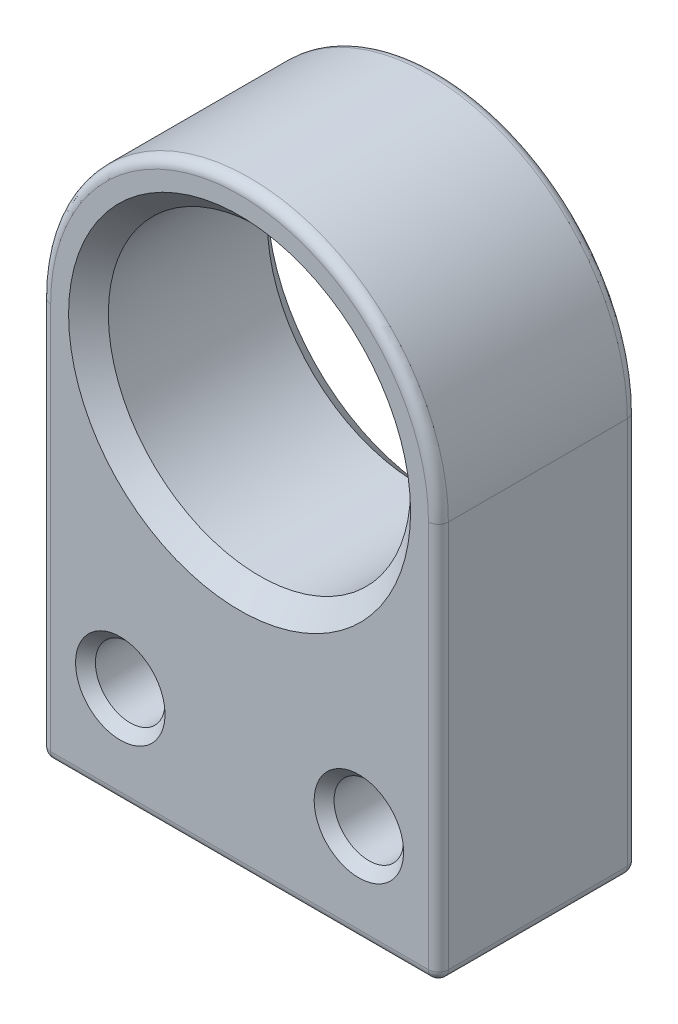
from build123d import *

# Parameters (mm, degrees)
SKETCH_1_W      = 20
SKETCH_1_H      = 10
SKETCH_1_R      = 1.75
EXTRUDE_1_DEPTH = 10
SKETCH_2_R      = 7.6
EXTRUDE_2_DEPTH = 10
CHAMFER_1_SIZE  = 1
CHAMFER_2_SIZE  = 0.5
FILLET_1_R      = 0.5


with BuildPart() as part:
    # 草图1 → 凸台-拉伸1 (new body)
    with BuildSketch(Plane.XY):
        Rectangle(SKETCH_1_W, SKETCH_1_H)
        with Locations((-6, 0)):
            Circle(SKETCH_1_R, mode=Mode.SUBTRACT)
        with Locations((6, 0)):
            Circle(SKETCH_1_R, mode=Mode.SUBTRACT)
    extrude(amount=EXTRUDE_1_DEPTH)

    # 草图2 → 凸台-拉伸2 (add)
    with BuildSketch(Plane.XY.offset(10)):
        with BuildLine():
            Line((-10, 15), (-10, 5))
            Line((-10, 5), (10, 5))
            Line((10, 5), (10, 15))
            ThreePointArc((10, 15), (0, 25), (-10, 15))
        make_face()
        with Locations((0, 15)):
            Circle(SKETCH_2_R, mode=Mode.SUBTRACT)
    extrude(amount=-EXTRUDE_2_DEPTH)

    # 倒角1
    chamfer_1_edges = [part.edges().sort_by_distance(p)[0] for p in [
        (-7.6, 15, 10),
        (-7.6, 15, 0),
    ]]
    chamfer(chamfer_1_edges, length=CHAMFER_1_SIZE)

    # 倒角2
    chamfer_2_edges = [part.edges().sort_by_distance(p)[0] for p in [
        (4.25, 0, 0),
        (4.25, 0, 10),
        (-7.75, 0, 0),
        (-7.75, 0, 10),
    ]]
    chamfer(chamfer_2_edges, length=CHAMFER_2_SIZE)

    # 圆角1
    fillet_1_edges = [part.edges().sort_by_distance(p)[0] for p in [
        (10, 5, 10),
        (0, 25, 10),
        (10, 5, 0),
        (0, 25, 0),
        (0, -5, 10),
        (10, -5, 5),
        (0, -5, 0),
        (-10, 5, 10),
        (-10, -5, 5),
        (-10, 5, 0),
    ]]
    fillet(fillet_1_edges, radius=FILLET_1_R)


solid = part.part
